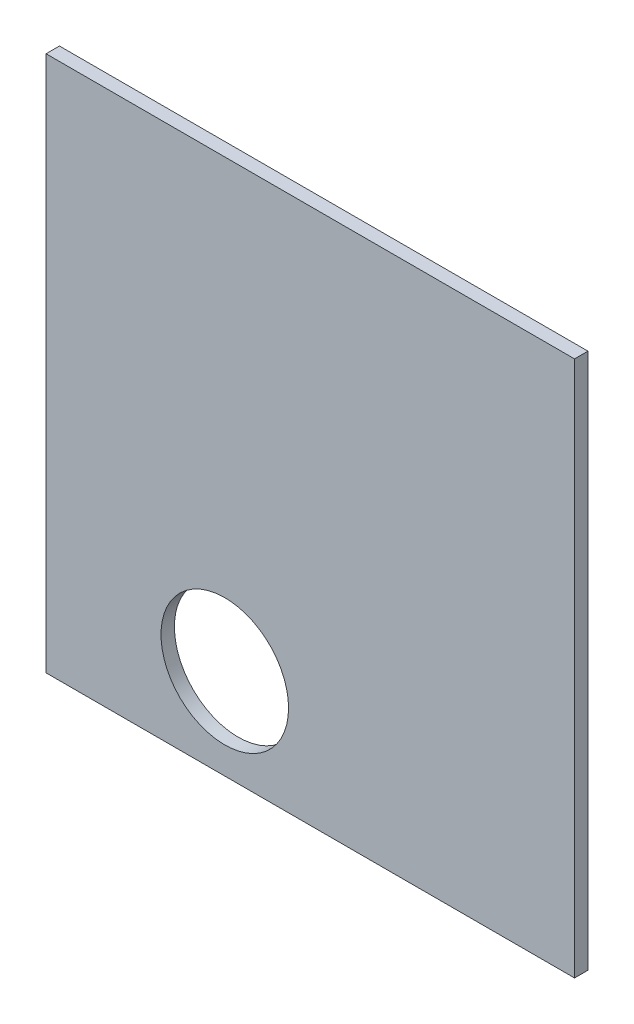
from build123d import *

# Parameters (mm, degrees)
SKETCH1_W           = 118.28
SKETCH1_H           = 120
BOSS_EXTRUDE1_DEPTH = 3
SKETCH2_R           = 14.275
CUT_EXTRUDE1_DEPTH  = 3


with BuildPart() as part:
    # Sketch1 → Boss-Extrude1 (new body)
    with BuildSketch(Plane.XY):
        with Locations((59.14, 60)):
            Rectangle(SKETCH1_W, SKETCH1_H)
    extrude(amount=BOSS_EXTRUDE1_DEPTH)

    # Sketch2 → Cut-Extrude1 (cut)
    with BuildSketch(Plane.XY.offset(3)):
        with Locations((40, 20.31)):
            Circle(SKETCH2_R)
    extrude(amount=-CUT_EXTRUDE1_DEPTH, mode=Mode.SUBTRACT)


solid = part.part
